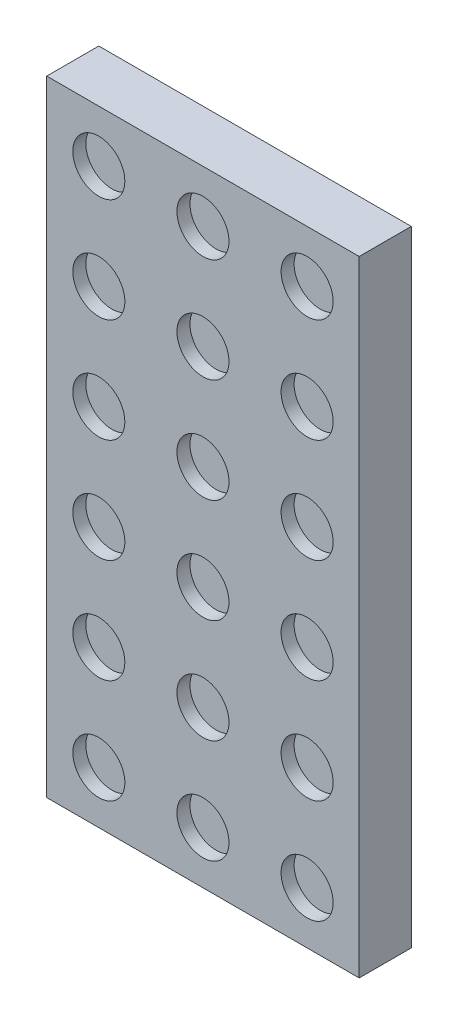
from build123d import *

# Parameters (mm, degrees)
SKETCH1_W           = 76.2
SKETCH1_H           = 152.4
BOSS_EXTRUDE1_DEPTH = 12.7
SKETCH3_R           = 6.35
CUT_EXTRUDE2_DEPTH  = 3.175
SKETCH5_R           = 31.75
CUT_EXTRUDE3_DEPTH  = 8.89
SKETCH6_W           = 2.54
SKETCH6_H           = 44.475410168
CUT_EXTRUDE4_DEPTH  = 8.89


with BuildPart() as part:
    # Sketch1 → Boss-Extrude1 (new body)
    with BuildSketch(Plane.XY):
        with Locations((38.1, 76.2)):
            Rectangle(SKETCH1_W, SKETCH1_H)
    extrude(amount=BOSS_EXTRUDE1_DEPTH)

    # Sketch3 → Cut-Extrude2 (cut)
    with BuildSketch(Plane.XY.offset(12.7)):
        with Locations((12.7, 139.7)):
            Circle(SKETCH3_R)
        with Locations((38.1, 139.7)):
            Circle(SKETCH3_R)
        with Locations((63.5, 139.7)):
            Circle(SKETCH3_R)
        with Locations((88.9, 139.7)):
            Circle(SKETCH3_R)
        with Locations((88.9, 114.3)):
            Circle(SKETCH3_R)
        with Locations((63.5, 114.3)):
            Circle(SKETCH3_R)
        with Locations((38.1, 114.3)):
            Circle(SKETCH3_R)
        with Locations((12.7, 114.3)):
            Circle(SKETCH3_R)
        with Locations((88.9, 88.9)):
            Circle(SKETCH3_R)
        with Locations((63.5, 88.9)):
            Circle(SKETCH3_R)
        with Locations((38.1, 88.9)):
            Circle(SKETCH3_R)
        with Locations((12.7, 88.9)):
            Circle(SKETCH3_R)
        with Locations((88.9, 63.5)):
            Circle(SKETCH3_R)
        with Locations((63.5, 63.5)):
            Circle(SKETCH3_R)
        with Locations((38.1, 63.5)):
            Circle(SKETCH3_R)
        with Locations((12.7, 63.5)):
            Circle(SKETCH3_R)
        with Locations((88.9, 38.1)):
            Circle(SKETCH3_R)
        with Locations((63.5, 38.1)):
            Circle(SKETCH3_R)
        with Locations((38.1, 38.1)):
            Circle(SKETCH3_R)
        with Locations((12.7, 38.1)):
            Circle(SKETCH3_R)
        with Locations((88.9, 12.7)):
            Circle(SKETCH3_R)
        with Locations((63.5, 12.7)):
            Circle(SKETCH3_R)
        with Locations((38.1, 12.7)):
            Circle(SKETCH3_R)
        with Locations((12.7, 12.7)):
            Circle(SKETCH3_R)
    extrude(amount=-CUT_EXTRUDE2_DEPTH, mode=Mode.SUBTRACT)

    # Sketch5 → Cut-Extrude3 (cut)
    with BuildSketch(Plane(origin=(0, 0, 0), x_dir=(-1, 0, 0), z_dir=(0, 0, -1))):
        with Locations((-38.1, 76.2)):
            Circle(SKETCH5_R)
    extrude(amount=-CUT_EXTRUDE3_DEPTH, mode=Mode.SUBTRACT)

    # Sketch6 → Cut-Extrude4 (cut)
    with BuildSketch(Plane(origin=(0, 0, 0), x_dir=(-1, 0, 0), z_dir=(0, 0, -1))):
        with Locations((-38.1, 22.237705084)):
            Rectangle(SKETCH6_W, SKETCH6_H)
    extrude(amount=-CUT_EXTRUDE4_DEPTH, mode=Mode.SUBTRACT)


solid = part.part
